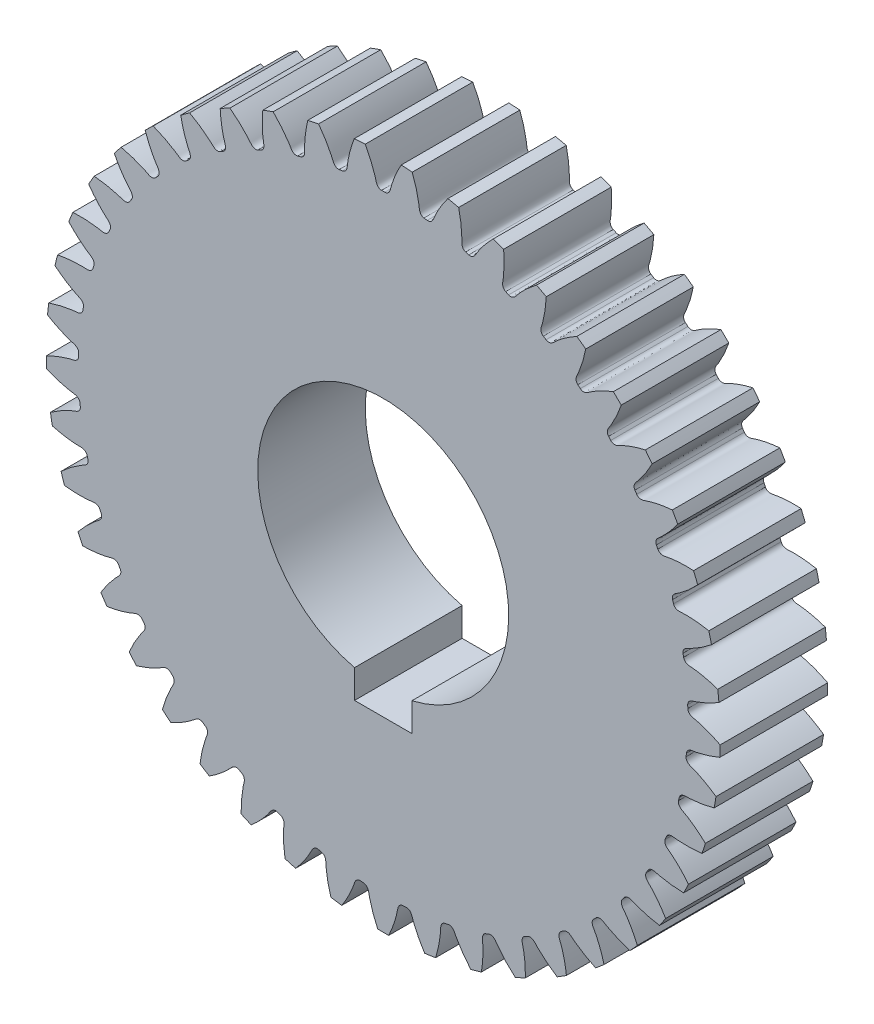
from build123d import *

# Parameters (mm, degrees)
GEAR_BASESKETCH_R                            = 47
F_2_0_90_0000MM_P_D_DEPTH                    = 7.5
TOOTH_CUT_START                              = -7.5
TOOTH_CUT_COARSE_PITCH_INVOLUTE_20_DEG_DEPTH = 15
PATTERN_CIRCULAR_1_COUNT                     = 45
SKETCH_3_R                                   = 17.5
CUT_EXTRUDE_2_DEPTH                          = 40
SKETCH_4_W                                   = 8
SKETCH_4_H                                   = 8.972258459
CUT_EXTRUDE_3_DEPTH                          = 40


# Read off the part's stored shape, not the designer's step: Tooth-Cut, Coarse Pitch Involute 20 deg
with BuildPart() as part:
    # Gear-BaseSketch → 2.0 模数    , 90.0000mm P.D. (new, symmetric)
    with BuildSketch(Plane.XY):
        Circle(GEAR_BASESKETCH_R)
    extrude(amount=F_2_0_90_0000MM_P_D_DEPTH, both=True)

    # Tooth-Cut_ Coarse Pitch Involute 20  2 → Tooth-Cut, Coarse Pitch Involute 20 deg (cut)
    with BuildSketch(Plane.XY.offset(TOOTH_CUT_START)):
        with BuildLine():
            ThreePointArc((2.511660121, 46.93284099), (0, 47), (-2.511660121, 46.93284099))
            add(Edge.make_bspline(
                [(-2.511660121, 46.93284099), (-2.462867681, 46.844352028), (-2.350400871, 46.639113519), (-2.183958028, 46.318634428), (-2.014761898, 45.97706266), (-1.86029352, 45.648136918), (-1.719805012, 45.332391041), (-1.592726164, 45.03023334), (-1.478427707, 44.742079187), (-1.376281933, 44.468317418), (-1.285644691, 44.209319167), (-1.205873002, 43.965432433), (-1.136279348, 43.736992968), (-1.076284401, 43.524288292), (-1.034659934, 43.364979171), (-1.009051165, 43.259580758), (-0.99421846, 43.2035075), (-0.974539291, 43.137407163), (-0.946212516, 43.056029542), (-0.904200963, 42.959324637), (-0.850332939, 42.861298457), (-0.777454745, 42.759547642), (-0.67364317, 42.654408638), (-0.52425327, 42.556943054), (-0.365694602, 42.506526389), (-0.261281444, 42.501140887), (-0.227370305, 42.499391793)],
                knots=[0.021543467, 0.021543467, 0.021543467, 0.021543467, 0.079025963, 0.154677291, 0.226953984, 0.295856042, 0.361383464, 0.423536252, 0.482314405, 0.537717922, 0.589746805, 0.638401052, 0.683680665, 0.725585642, 0.764115984, 0.777340537, 0.787287501, 0.797107436, 0.816569406, 0.836266616, 0.857020698, 0.880084648, 0.907259577, 0.940589476, 0.980704744, 1, 1, 1, 1], degree=3))
            ThreePointArc((-0.227370305, 42.499391793), (0, 42.5), (0.227370305, 42.499391793))
            add(Edge.make_bspline(
                [(0.227370305, 42.499391793), (0.261281444, 42.501140887), (0.365694602, 42.506526389), (0.52425327, 42.556943054), (0.67364317, 42.654408638), (0.777454745, 42.759547642), (0.850332939, 42.861298457), (0.904200963, 42.959324637), (0.946212516, 43.056029542), (0.974539291, 43.137407163), (0.99421846, 43.2035075), (1.009051165, 43.259580758), (1.034659934, 43.364979171), (1.076284401, 43.524288292), (1.136279348, 43.736992968), (1.205873002, 43.965432433), (1.285644691, 44.209319167), (1.376281933, 44.468317418), (1.478427707, 44.742079187), (1.592726164, 45.03023334), (1.719805012, 45.332391041), (1.86029352, 45.648136918), (2.014761898, 45.97706266), (2.183958028, 46.318634428), (2.350400871, 46.639113519), (2.462867681, 46.844352028), (2.511660121, 46.93284099)],
                knots=[0, 0, 0, 0, 0.019295256, 0.059410524, 0.092740423, 0.119915352, 0.142979302, 0.163733384, 0.183430594, 0.202892564, 0.212712499, 0.222659463, 0.235884016, 0.274414358, 0.316319335, 0.361598948, 0.410253195, 0.462282078, 0.517685595, 0.576463748, 0.638616536, 0.704143958, 0.773046016, 0.845322709, 0.920974037, 0.978456533, 0.978456533, 0.978456533, 0.978456533], degree=3))
        make_face()
    tooth_cut_coarse_pitch_involute_20_deg = extrude(amount=TOOTH_CUT_COARSE_PITCH_INVOLUTE_20_DEG_DEPTH, mode=Mode.SUBTRACT)

    # 阵列(圆周)1: Tooth-Cut, Coarse Pitch Involute 20 deg ×45 about axis
    pattern_circular_1_axis = Axis((0, 0, -88.99), (0, 0, 1))
    for i in range(1, PATTERN_CIRCULAR_1_COUNT):
        add(tooth_cut_coarse_pitch_involute_20_deg.rotate(pattern_circular_1_axis, i * 360 / PATTERN_CIRCULAR_1_COUNT), mode=Mode.SUBTRACT)

    # 草图3 → 切除-拉伸2 (cut)
    with BuildSketch(Plane.XY.offset(7.5)):
        Circle(SKETCH_3_R)
    extrude(amount=-CUT_EXTRUDE_2_DEPTH, mode=Mode.SUBTRACT)

    # 草图4 → 切除-拉伸3 (cut)
    with BuildSketch(Plane(origin=(0, 0, -7.5), x_dir=(-1, 0, 0), z_dir=(0, 0, -1))):
        with Locations((0, -16.51387077)):
            Rectangle(SKETCH_4_W, SKETCH_4_H)
    extrude(amount=-CUT_EXTRUDE_3_DEPTH, mode=Mode.SUBTRACT)


solid = part.part
